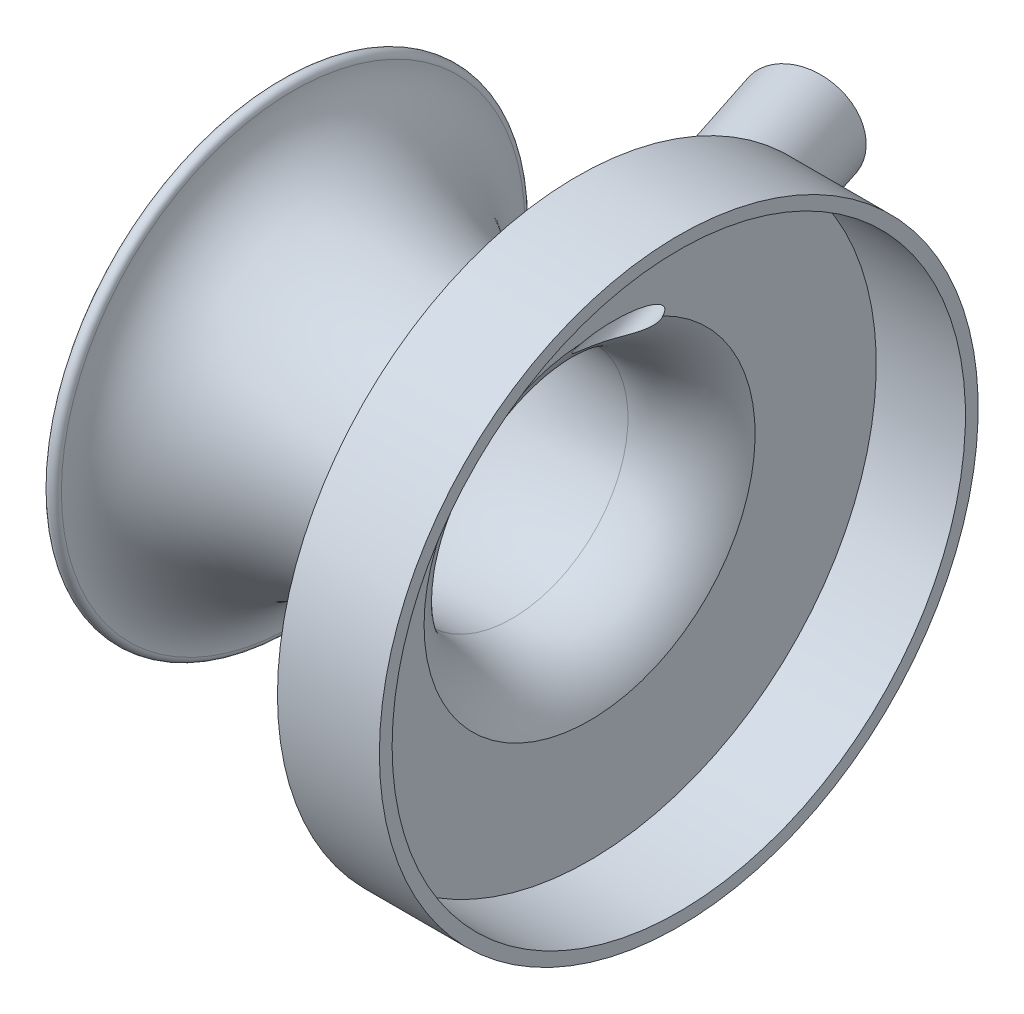
from build123d import *

# Parameters (mm, degrees)
BOSS_EXTRUDE1_REACH      = 136.648
SKETCH2_R                = 5.55625
SKETCH2_R_2              = 3.175
CUT_EXTRUDE1_DEPTH       = 135.647939489
CUT_EXTRUDE1_DEPTH_BACK  = 40.64
SKETCH2_3_R              = 3.175
BOSS_EXTRUDE3_DEPTH      = 25.4
BOSS_EXTRUDE3_DEPTH_BACK = 1.016
SKETCH2_4_R              = 10.16
SKETCH2_4_R_2            = 5.55625


with BuildPart() as part:
    # Sketch1 → Revolve1 (revolve)
    with BuildSketch(Plane.XY):
        with BuildLine():
            Line((-17.78, 33.403326565), (-17.78, 57.553265565))
            Line((-17.78, 57.553265565), (0, 57.553265565))
            Line((0, 57.553265565), (0, 60.093265565))
            Line((0, 60.093265565), (-20.32, 60.093265565))
            Line((-20.32, 60.093265565), (-20.32, 33.982777374))
            ThreePointArc((-20.32, 33.982777374), (-25.649919472, 28.187081223), (-33.226351252, 26.043295565))
            add(Edge.make_bspline(
                [(-76.886411252, 46.603325565), (-76.886411252, 46.009369382), (-76.77114578, 44.835835641), (-76.066127929, 42.442319734), (-74.228016579, 39.374517329), (-70.376069442, 35.748399313), (-64.978747628, 32.451637208), (-58.261766665, 29.690948486), (-50.507417024, 27.617336174), (-42.055940092, 26.333096739), (-36.150491082, 26.043295565), (-33.226351252, 26.043295565)],
                knots=[-3.141592654, -3.141592654, -3.141592654, -3.141592654, -3.043417883, -2.945243113, -2.748893572, -2.552544031, -2.35619449, -2.159844949, -1.963495408, -1.767145868, -1.570796327, -1.570796327, -1.570796327, -1.570796327], degree=3))
            ThreePointArc((-76.886411252, 46.603325565), (-78.156411252, 47.873325565), (-79.426411252, 46.603325565))
            add(Edge.make_bspline(
                [(-79.426411252, 46.603325565), (-79.426411252, 23.503295565), (-33.226351252, 23.503295565)],
                knots=[3.141592654, 3.141592654, 3.141592654, 4.71238898, 4.71238898, 4.71238898], degree=2, weights=[1, 0.707106781, 1]))
            ThreePointArc((-33.226351252, 23.503295565), (-24.053015152, 26.190723397), (-17.78, 33.403326565))
        make_face()
    revolve(axis=Axis((-33.226351252, 0.403265565, 0), (1, 0, 0)))


with BuildPart() as body_2:

    # Sketch2 → Boss-Extrude1 (new, up to next)
    with BuildSketch(Plane(origin=(-13.343353817, 0, -41.066620374), x_dir=(0, -1, 0), z_dir=(-0.3090169943749514, 0, -0.9510565162951523)), mode=Mode.PRIVATE) as boss_extrude1_sk1:
        with Locations((-30.889259617, 15.45046582)):
            Circle(SKETCH2_R)
        with Locations((-30.889259617, 15.45046582)):
            Circle(SKETCH2_R_2, mode=Mode.SUBTRACT)
    boss_extrude1_tool1 = extrude(boss_extrude1_sk1.sketch, amount=-BOSS_EXTRUDE1_REACH, mode=Mode.PRIVATE) - part.part
    add(boss_extrude1_tool1.solids().sort_by_distance((-28.03762, 36.288355, -36.292164))[0])


with BuildPart() as part_1:
    add(part.part)

    # Sketch2<3> → Cut-Extrude1 (cut, two sides: drawn at the far end of the back side and taken through both)
    with BuildSketch(Plane(origin=(-13.343353817, 0, -41.066620374), x_dir=(0, -1, 0), z_dir=(-0.3090169943749514, 0, -0.9510565162951523)).offset(-CUT_EXTRUDE1_DEPTH_BACK)):
        with Locations((-30.889259617, 15.45046582)):
            Circle(SKETCH2_3_R)
    extrude(amount=CUT_EXTRUDE1_DEPTH + CUT_EXTRUDE1_DEPTH_BACK, mode=Mode.SUBTRACT)

    add(body_2.part)  # Boss-Extrude3 merges body 2
    # Sketch2<4> → Boss-Extrude3 (add, two sides: drawn at the far end of the back side and taken through both)
    with BuildSketch(Plane(origin=(-13.343353817, 0, -41.066620374), x_dir=(0, -1, 0), z_dir=(-0.3090169943749514, 0, -0.9510565162951523)).offset(-BOSS_EXTRUDE3_DEPTH_BACK)):
        with Locations((-30.889259617, 15.45046582)):
            Circle(SKETCH2_4_R)
        with Locations((-30.889259617, 15.45046582)):
            Circle(SKETCH2_4_R_2, mode=Mode.SUBTRACT)
    extrude(amount=BOSS_EXTRUDE3_DEPTH + BOSS_EXTRUDE3_DEPTH_BACK)


solid = part_1.part
